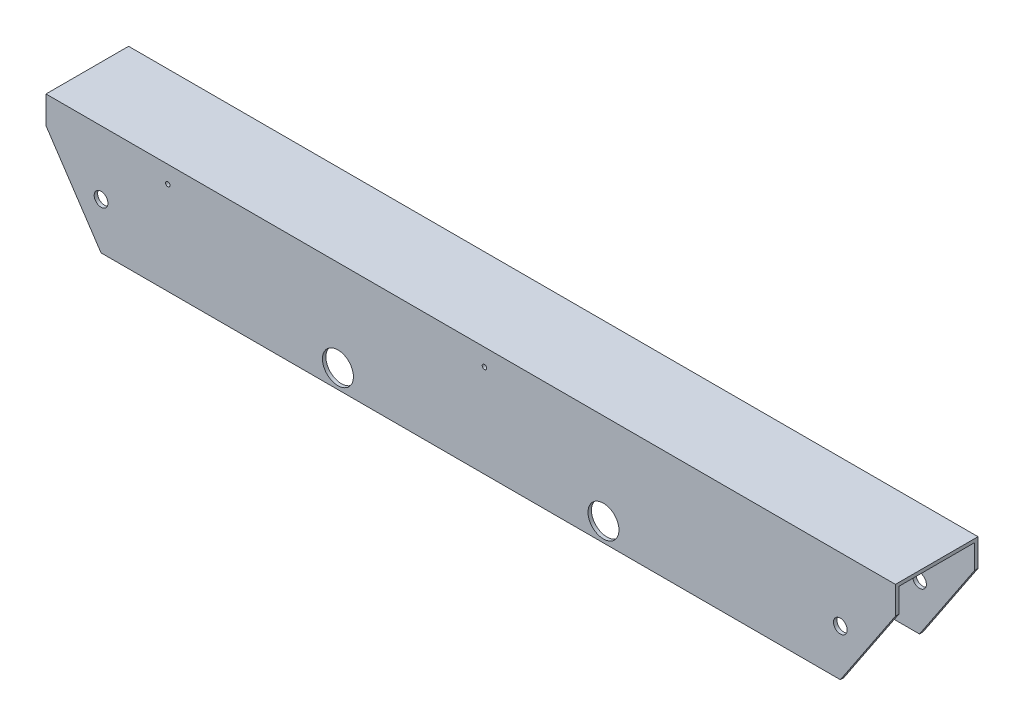
from build123d import *

# Parameters (mm, degrees)
BOSS_EXTRUDE1_DEPTH = 391.865756272
SKETCH2_R           = 6.35
SKETCH2_R_2         = 14.2875
SKETCH2_R_3         = 2.0828
CUT_EXTRUDE1_DEPTH  = 141.732
SKETCH14_R          = 3.302
SKETCH14_W          = 25.4
SKETCH14_H          = 25.4
CUT_EXTRUDE12_DEPTH = 23.114
CUT_EXTRUDE13_DEPTH = 101.6


with BuildPart() as part:
    # Sketch1 → Boss-Extrude1 (new, symmetric)
    with BuildSketch(Plane(origin=(0, 0, 0), x_dir=(0, 0, -1), z_dir=(1, 0, 0))):
        Polygon((-38.1, 50.8), (38.1, 50.8), (38.1, -50.8), (34.925, -50.8), (34.925, 47.625), (-34.925, 47.625), (-34.925, -50.8), (-38.1, -50.8), align=None)
    extrude(amount=BOSS_EXTRUDE1_DEPTH, both=True)

    # Sketch2 → Cut-Extrude1 (cut)
    with BuildSketch(Plane.XY.offset(38.1)):
        with Locations((-341.065756187, -7.9375)):
            Circle(SKETCH2_R)
        with Locations((122.51182, -33.3375)):
            Circle(SKETCH2_R_2)
        with Locations((341.065756187, -7.9375)):
            Circle(SKETCH2_R)
        with Locations((12.7, 34.925)):
            Circle(SKETCH2_R_3)
        with Locations((-279.4, 34.925)):
            Circle(SKETCH2_R_3)
        with Locations((-122.51182, -33.3375)):
            Circle(SKETCH2_R_2)
    extrude(amount=-CUT_EXTRUDE1_DEPTH, mode=Mode.SUBTRACT)

    # Sketch14 → Cut-Extrude12 (cut)
    with BuildSketch(Plane(origin=(0, 0, -38.1), x_dir=(-1, 0, 0), z_dir=(0, 0, -1))):
        with Locations((-160.61182, -35.123476108)):
            Circle(SKETCH14_R)
        with Locations((-160.61182, 41.076523892)):
            Circle(SKETCH14_R)
        with Locations((-84.41182, 41.076523892)):
            Circle(SKETCH14_R)
        with Locations((-84.41182, -35.123476108)):
            Circle(SKETCH14_R)
        with Locations((-12.7, 34.925)):
            Rectangle(SKETCH14_W, SKETCH14_H)
        with Locations((279.4, 34.925)):
            Rectangle(SKETCH14_W, SKETCH14_H)
    extrude(amount=-CUT_EXTRUDE12_DEPTH, mode=Mode.SUBTRACT)

    # Sketch16 → Cut-Extrude13 (cut)
    with BuildSketch(Plane.XY.offset(38.1)):
        Polygon((-391.865756272, 25.4), (-341.065756272, -50.8), (-391.865756272, -50.8), align=None)
        Polygon((341.065756272, -50.8), (391.865756272, -50.8), (391.865756272, 25.4), align=None)
    extrude(amount=-CUT_EXTRUDE13_DEPTH, mode=Mode.SUBTRACT)


solid = part.part
